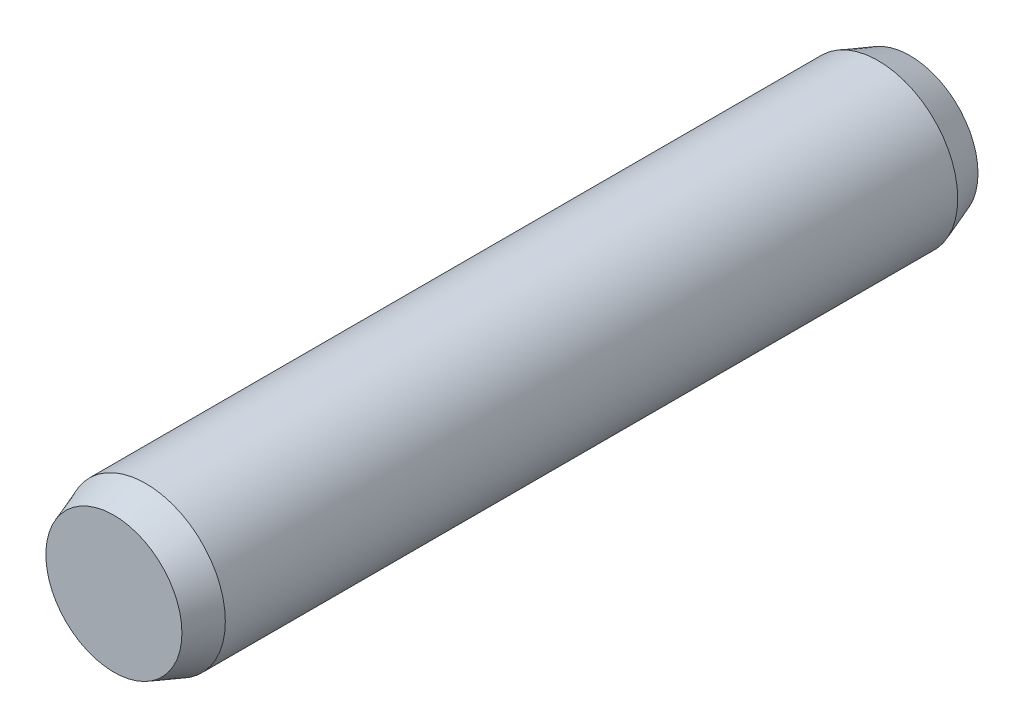
from build123d import *

# Parameters (mm, degrees)
E_CORPS_R   = 0.4
CORPS_DEPTH = 2
CHANF_SIZE  = 0.16
CHANF_SIZE2 = 0.058235237


with BuildPart() as part:
    # E_CORPS → CORPS (new, symmetric)
    with BuildSketch(Plane.XY):
        Circle(E_CORPS_R)
    extrude(amount=CORPS_DEPTH, both=True)

    # CHANF
    chanf_edges = [part.edges().sort_by_distance(p)[0] for p in [
        (-0.4, 0, 2),
        (-0.4, 0, -2),
    ]]
    chanf_side = [part.faces().sort_by_distance(p)[0] for p in [
        (-0.4, 0, 0),
    ]]
    chamfer(chanf_edges, length=CHANF_SIZE, length2=CHANF_SIZE2, reference=chanf_side[0])


solid = part.part
